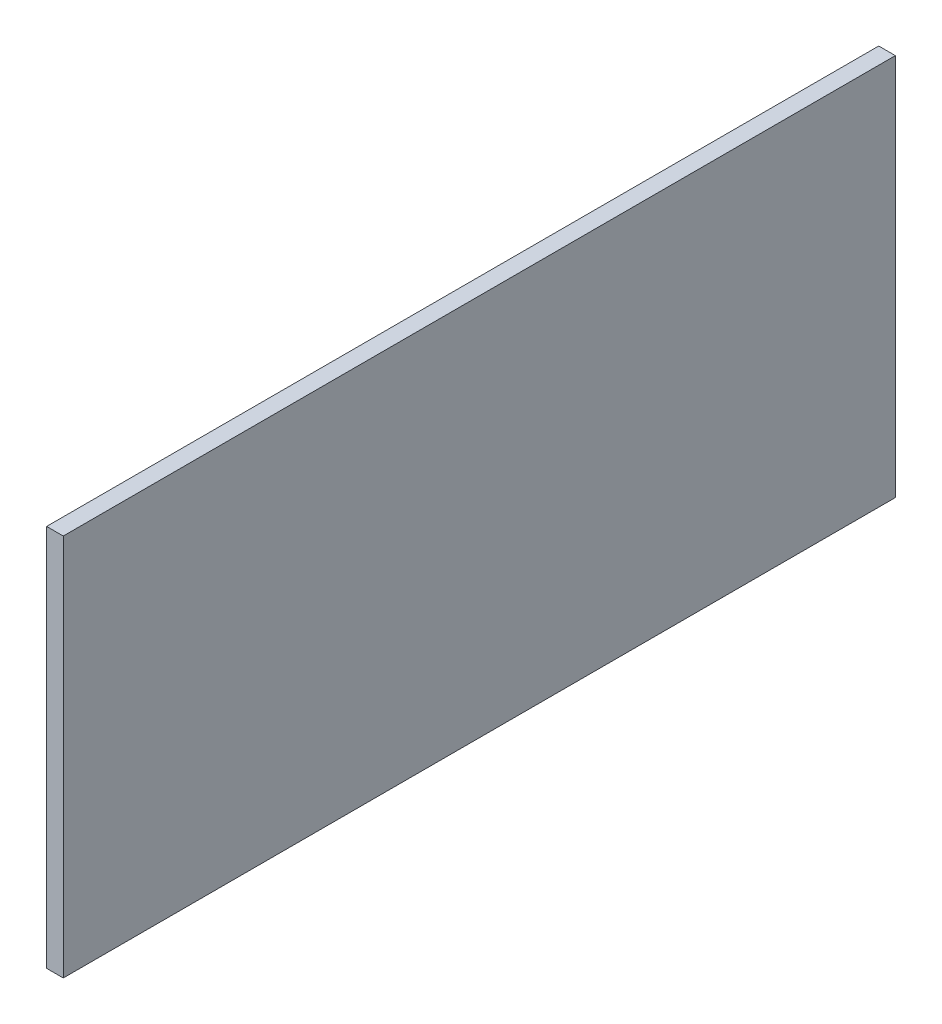
from build123d import *

# Parameters (mm, degrees)
SKETCH1_W           = 100
SKETCH1_H           = 46
BOSS_EXTRUDE1_DEPTH = 2


with BuildPart() as part:
    # Sketch1 → Boss-Extrude1 (new body)
    with BuildSketch(Plane(origin=(0, 0, 0), x_dir=(0, 0, -1), z_dir=(1, 0, 0))):
        with Locations((50, 23)):
            Rectangle(SKETCH1_W, SKETCH1_H)
    extrude(amount=BOSS_EXTRUDE1_DEPTH)


solid = part.part
